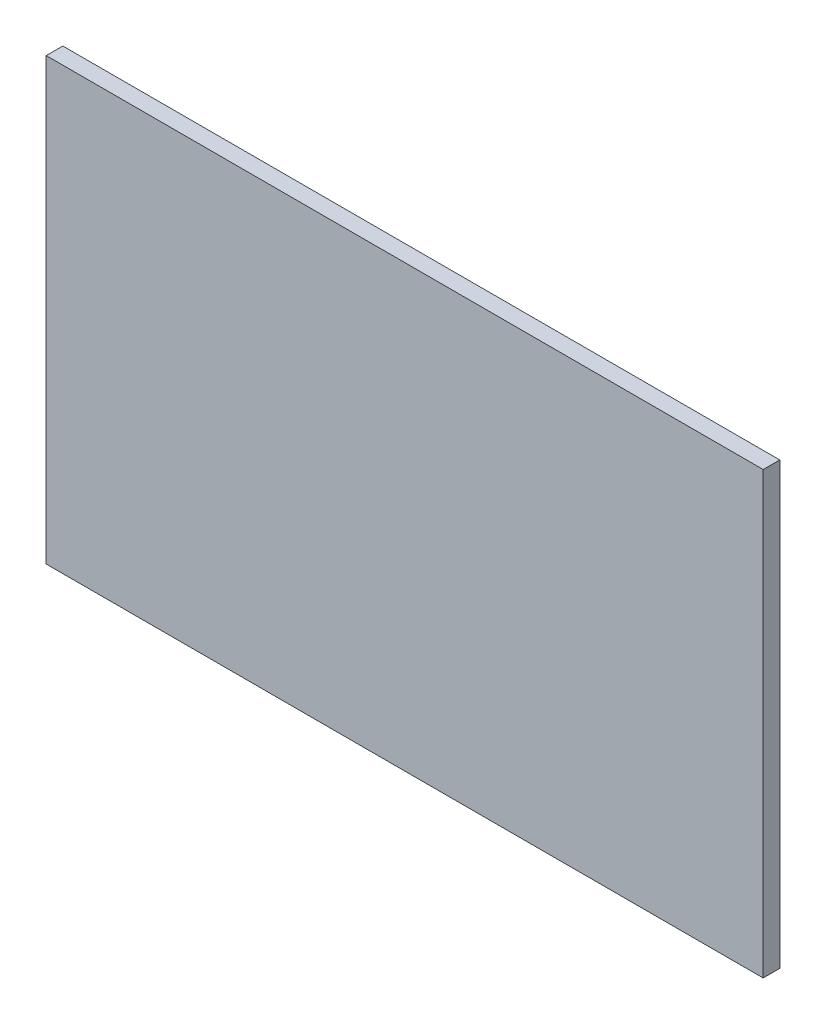
from build123d import *

# Parameters (mm, degrees)
SKICA1_W                = 129.6
SKICA1_H                = 79.6
P_IDAT_VYSUNUT_M1_DEPTH = 3


with BuildPart() as part:
    # Skica1 → Přidat vysunutím1 (new body)
    with BuildSketch(Plane.XY):
        with Locations((64.8, 39.8)):
            Rectangle(SKICA1_W, SKICA1_H)
    extrude(amount=P_IDAT_VYSUNUT_M1_DEPTH)


solid = part.part
